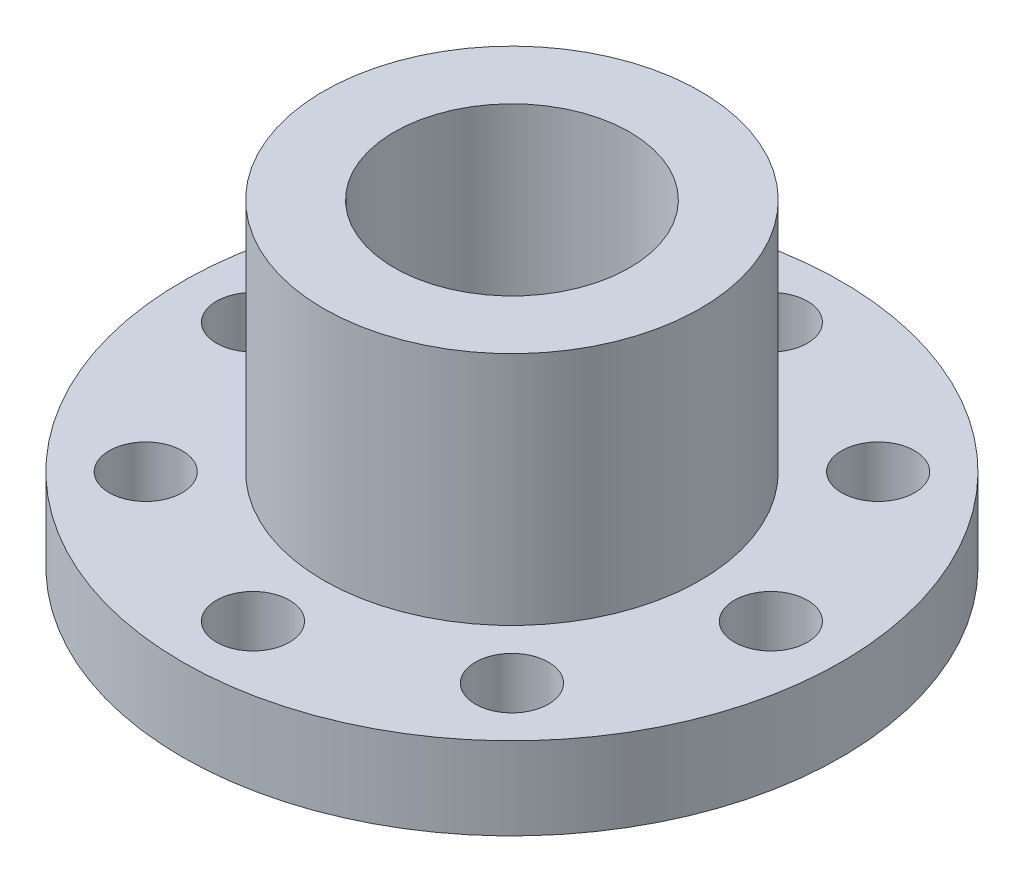
from build123d import *

# Parameters (mm, degrees)
SKETCH1_R                  = 14
BOSS_EXTRUDE1_DEPTH        = 1.75
M2_5_CLEARANCE_HOLE1_D     = 3.1
M2_5_CLEARANCE_HOLE1_DEPTH = 6
M2_5_CLEARANCE_HOLE1_TIP   = 0.931333959
SKETCH9_R                  = 8
BOSS_EXTRUDE2_DEPTH        = 10
SKETCH7_R                  = 5
CUT_EXTRUDE1_DEPTH         = 24.963513933


with BuildPart() as part:
    # Sketch1 → Boss-Extrude1 (new, symmetric)
    with BuildSketch(Plane(origin=(0, 0, 0), x_dir=(1, 0, 0), z_dir=(0, 1, 0))):
        Circle(SKETCH1_R)
    extrude(amount=BOSS_EXTRUDE1_DEPTH, both=True)

    # M2.5 Clearance Hole1
    with Locations(Plane(origin=(0, 1.75, 0), x_dir=(1, 0, 0), z_dir=(0, 1, 0))):
        with Locations((-11, 0), (-7.778174593, 7.778174593), (0, 11), (7.778174593, 7.778174593), (11, 0), (7.778174593, -7.778174593), (0, -11), (-7.778174593, -7.778174593)):
            Hole(M2_5_CLEARANCE_HOLE1_D / 2, depth=M2_5_CLEARANCE_HOLE1_DEPTH)
            with Locations((0, 0, -(M2_5_CLEARANCE_HOLE1_DEPTH + M2_5_CLEARANCE_HOLE1_TIP / 2))):  # 118° drill point
                Cone(0, M2_5_CLEARANCE_HOLE1_D / 2, M2_5_CLEARANCE_HOLE1_TIP, mode=Mode.SUBTRACT)

    # Sketch9 → Boss-Extrude2 (add)
    with BuildSketch(Plane(origin=(0, 1.75, 0), x_dir=(1, 0, 0), z_dir=(0, 1, 0))):
        Circle(SKETCH9_R)
    extrude(amount=BOSS_EXTRUDE2_DEPTH)

    # Sketch7 → Cut-Extrude1 (cut, through all)
    with BuildSketch(Plane.XZ.offset(1.75)):
        Circle(SKETCH7_R)
    extrude(amount=-CUT_EXTRUDE1_DEPTH, mode=Mode.SUBTRACT)


solid = part.part
